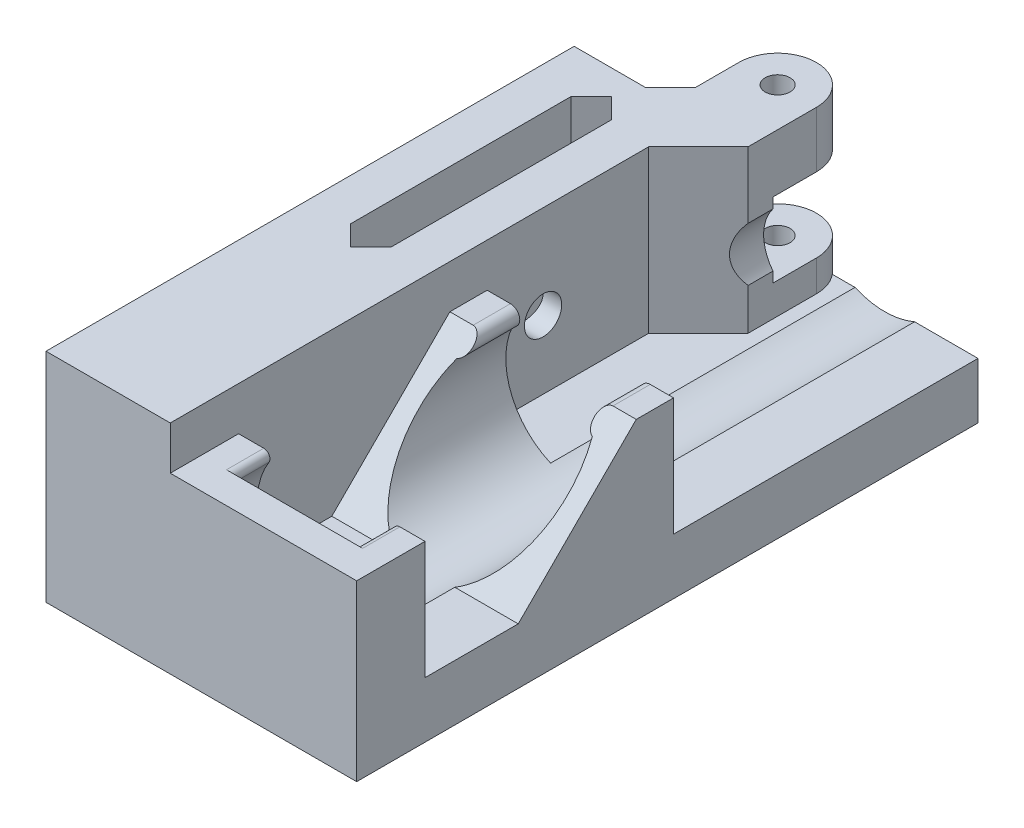
from build123d import *
from build123d.topology import SkipClean

# Parameters (mm, degrees)
SKETCH1_W               = 20
SKETCH1_H               = 30
BOSS_EXTRUDE1_DEPTH     = 85
SKETCH3_R               = 7
CUT_EXTRUDE1_DEPTH      = 75
SKETCH4_R               = 3
CUT_EXTRUDE2_DEPTH      = 89.600225733
SKETCH5_W               = 6.5
SKETCH5_H               = 42
CUT_EXTRUDE3_DEPTH      = 91.691785747
SKETCH6_W               = 85
SKETCH6_H               = 4
BOSS_EXTRUDE2_DEPTH     = 30
BOSS_EXTRUDE3_DEPTH     = 11
SKETCH8_R               = 12
CUT_EXTRUDE4_DEPTH      = 96.131488042
SKETCH9_W               = 30
SKETCH9_H               = 23
BOSS_EXTRUDE4_DEPTH     = 5
BOSS_EXTRUDE5_START     = -45
BOSS_EXTRUDE5_DEPTH     = 6
SKETCH10_W              = 50
SKETCH10_H              = 85
SKETCH10_W_2            = 6.5
SKETCH10_H_2            = 42
BOSS_EXTRUDE6_DEPTH     = 5
BOSS_EXTRUDE7_DEPTH     = 15
BOSS_EXTRUDE8_START     = -9
BOSS_EXTRUDE8_DEPTH     = 35
CUT_EXTRUDE5_DEPTH      = 110.544511501
CUT_EXTRUDE5_DEPTH_BACK = 11
SKETCH13_W              = 12.5
SKETCH13_H              = 12
SKETCH14_R              = 2
CUT_EXTRUDE6_DEPTH      = 25
CUT_EXTRUDE7_DEPTH      = 97.046863561
SKETCH17_R              = 7
CUT_EXTRUDE8_DEPTH      = 10
CHAMFER2_SIZE           = 4
CHAMFER3_START          = 10
CHAMFER3_DEPTH          = 10.204168477
CHAMFER3_START_2        = 29.795831523
CHAMFER3_2_DEPTH        = 10.204168477
CHAMFER3_START_3        = 40
CHAMFER3_3_DEPTH        = 19
BOSS_EXTRUDE9_DEPTH     = 6
FILLET1_R               = 1
BOSS_EXTRUDE10_REACH    = 70.019
CHAMFER5_SIZE           = 3.25


with BuildPart() as part:
    # Sketch1 → Boss-Extrude1 (new body)
    with BuildSketch(Plane.XY):
        Rectangle(SKETCH1_W, SKETCH1_H)
    extrude(amount=BOSS_EXTRUDE1_DEPTH)

    # Sketch3 → Cut-Extrude1 (cut)
    with BuildSketch(Plane.XY):
        Circle(SKETCH3_R)
    extrude(amount=CUT_EXTRUDE1_DEPTH, mode=Mode.SUBTRACT)

    # Sketch4 → Cut-Extrude2 (cut, through all)
    with BuildSketch(Plane.ZY.offset(10)):
        with Locations((25, 0)):
            Circle(SKETCH4_R)
    extrude(amount=-CUT_EXTRUDE2_DEPTH, mode=Mode.SUBTRACT)

    # Sketch5 → Cut-Extrude3 (cut, through all)
    with BuildSketch(Plane(origin=(0, 15, 0), x_dir=(1, 0, 0), z_dir=(0, 1, 0))):
        with Locations((0, -25)):
            Rectangle(SKETCH5_W, SKETCH5_H)
    extrude(amount=-CUT_EXTRUDE3_DEPTH, mode=Mode.SUBTRACT)

    # Sketch6 → Boss-Extrude2 (add)
    with BuildSketch(Plane(origin=(10, 0, 0), x_dir=(0, 0, -1), z_dir=(1, 0, 0))):
        with Locations((-42.5, -13)):
            Rectangle(SKETCH6_W, SKETCH6_H)
    extrude(amount=BOSS_EXTRUDE2_DEPTH)

    # Sketch7 → Boss-Extrude3 (add)
    with BuildSketch(Plane.XY.offset(85)):
        with BuildLine():
            Line((10, -11), (20.204168477, -11))
            ThreePointArc((20.204168477, -11), (14.96132533, -6.574573055), (13, 0))
            Line((13, 0), (13, 8))
            Line((13, 8), (10, 8))
            Line((10, 8), (10, -11))
        make_face()
        with BuildLine():
            Line((40, -11), (40, 8))
            Line((40, 8), (37, 8))
            Line((37, 8), (37, 0))
            ThreePointArc((37, 0), (35.03867467, -6.574573055), (29.795831523, -11))
            Line((29.795831523, -11), (40, -11))
        make_face()
    extrude(amount=-BOSS_EXTRUDE3_DEPTH)

    # Sketch8 → Cut-Extrude4 (cut, through all)
    with SkipClean():  # the faces are left unmerged after this step: merging them gives an invalid solid
        with BuildSketch(Plane.XY.offset(85)):
            with Locations((25, 0)):
                Circle(SKETCH8_R)
        extrude(amount=-CUT_EXTRUDE4_DEPTH, mode=Mode.SUBTRACT)

    # Sketch9 → Boss-Extrude4 (add)
    with SkipClean():  # the faces are left unmerged after this step: merging them gives an invalid solid
        with BuildSketch(Plane.XY.offset(85)):
            with Locations((25, -3.5)):
                Rectangle(SKETCH9_W, SKETCH9_H)
        extrude(amount=-BOSS_EXTRUDE4_DEPTH)

    # Sketch7<3> → Boss-Extrude5 (add)
    with SkipClean():  # the faces are left unmerged after this step: merging them gives an invalid solid
        with BuildSketch(Plane.XY.offset(85).offset(BOSS_EXTRUDE5_START)):
            with BuildLine():
                Line((40, -11), (40, 0))
                Line((40, 0), (40, 8))
                Line((40, 8), (37, 8))
                Line((37, 8), (37, 0))
                ThreePointArc((37, 0), (35.03867467, -6.574573055), (29.795831523, -11))
                Line((29.795831523, -11), (40, -11))
            make_face()
            with BuildLine():
                Line((10, -11), (20.204168477, -11))
                ThreePointArc((20.204168477, -11), (14.96132533, -6.574573055), (13, 0))
                Line((13, 0), (13, 8))
                Line((13, 8), (10, 8))
                Line((10, 8), (10, -11))
            make_face()
        extrude(amount=-BOSS_EXTRUDE5_DEPTH)

    # Sketch10 → Boss-Extrude6 (add)
    with SkipClean():  # the faces are left unmerged after this step: merging them gives an invalid solid
        with BuildSketch(Plane.XZ.offset(15)):
            with Locations((15, 42.5)):
                Rectangle(SKETCH10_W, SKETCH10_H)
            with Locations((0, 25)):
                Rectangle(SKETCH10_W_2, SKETCH10_H_2, mode=Mode.SUBTRACT)
        extrude(amount=BOSS_EXTRUDE6_DEPTH)

    # Sketch11 → Boss-Extrude7 (add)
    with BuildSketch(Plane(origin=(0, 0, 0), x_dir=(-1, 0, 0), z_dir=(0, 0, -1))):
        with BuildLine():
            Line((-10, -11), (10, -11))
            Line((10, -11), (10, -20))
            Line((10, -20), (-40, -20))
            Line((-40, -20), (-40, -11))
            Line((-40, -11), (-29.795831523, -11))
            ThreePointArc((-29.795831523, -11), (-25, -12), (-20.204168477, -11))
            Line((-20.204168477, -11), (-10, -11))
        make_face()
    extrude(amount=BOSS_EXTRUDE7_DEPTH)

    # Sketch12 → Boss-Extrude8 (add)
    with SkipClean():  # the faces are left unmerged after this step: merging them gives an invalid solid
        with BuildSketch(Plane(origin=(0, -11, 0), x_dir=(1, 0, 0), z_dir=(0, 1, 0)).offset(BOSS_EXTRUDE8_START)):
            with BuildLine():
                Line((5.5, 0), (10, 0))
                Line((10, 0), (10, -8))
                Line((10, -8), (18, 0))
                Line((18, 0), (18, 11))
                ThreePointArc((18, 11), (11.75, 17.25), (5.5, 11))
                Line((5.5, 11), (5.5, 0))
            make_face()
        extrude(amount=BOSS_EXTRUDE8_DEPTH)

    # Sketch13 → Cut-Extrude5 (cut, two sides: drawn at the far end of the back side and taken through both)
    with BuildSketch(Plane(origin=(0, 0, -15), x_dir=(-1, 0, 0), z_dir=(0, 0, -1)).offset(-CUT_EXTRUDE5_DEPTH_BACK)):
        with Locations((-11.75, 0)):
            Rectangle(SKETCH13_W, SKETCH13_H)
    extrude(amount=CUT_EXTRUDE5_DEPTH + CUT_EXTRUDE5_DEPTH_BACK, mode=Mode.SUBTRACT)

    # Sketch14 → Cut-Extrude6 (cut)
    with BuildSketch(Plane(origin=(0, 15, 0), x_dir=(1, 0, 0), z_dir=(0, 1, 0))):
        with Locations(Location((11.75, 11, 0), (0, 0, 270))):
            Circle(SKETCH14_R)
    extrude(amount=-CUT_EXTRUDE6_DEPTH, mode=Mode.SUBTRACT)

    # Sketch16 → Cut-Extrude7 (cut, through all)
    with SkipClean():  # the faces are left unmerged after this step: merging them gives an invalid solid
        with BuildSketch(Plane.XY):
            with BuildLine():
                Line((5.5, 4.330127019), (5.5, -4.330127019))
                ThreePointArc((5.5, -4.330127019), (7, 0), (5.5, 4.330127019))
            make_face()
        extrude(amount=-CUT_EXTRUDE7_DEPTH, mode=Mode.SUBTRACT)

    # Sketch17 → Cut-Extrude8 (cut)
    with SkipClean():  # the faces are left unmerged after this step: merging them gives an invalid solid
        with BuildSketch(Plane(origin=(0, 0, -4), x_dir=(-1, 0, 0), z_dir=(0, 0, -1))):
            with Locations((-23.5, 0)):
                Circle(SKETCH17_R)
        extrude(amount=-CUT_EXTRUDE8_DEPTH, mode=Mode.SUBTRACT)

    # Chamfer2
    # the kernel refuses this chamfer: 4 mm, written as the material it adds along each edge
    with BuildSketch(Plane(origin=(5.5, -21.286731952, 0), x_dir=(-1, 0, 0), z_dir=(0, 1, 0))) as chamfer2_piece_1_section:
        Polygon((CHAMFER2_SIZE, 0), (0, -CHAMFER2_SIZE), (0, 0), align=None)
    chamfer2_piece_1 = extrude(amount=27.243336885, mode=Mode.PRIVATE)
    chamfer2_piece_1 = chamfer2_piece_1 - Plane(origin=(0, 0, 0), x_dir=(1, 0, 0), z_dir=(0, 0, -1)) * Cylinder(7, 71, mode=Mode.PRIVATE)
    chamfer2_piece_1 = split(chamfer2_piece_1, bisect_by=Plane(origin=(5.5, -20, 0), z_dir=(0, 1, 0)), keep=Keep.TOP, mode=Mode.PRIVATE)
    add(chamfer2_piece_1)
    with BuildSketch(Plane(origin=(5.5, -5.956604933, 0), x_dir=(-1, 0, 0), z_dir=(0, 1, 0))) as chamfer2_piece_2_section:
        Polygon((CHAMFER2_SIZE, 0), (0, -CHAMFER2_SIZE), (0, 0), align=None)
    chamfer2_piece_2 = extrude(amount=20.956604933, mode=Mode.PRIVATE)
    chamfer2_piece_2 = chamfer2_piece_2 - Plane(origin=(0, 0, 0), x_dir=(1, 0, 0), z_dir=(0, 0, -1)) * Cylinder(7, 58, mode=Mode.PRIVATE)
    add(chamfer2_piece_2)

    # Chamfer3: read off the stored shape, not the designer's step
    # Chamfer3 outline → Chamfer3 (add)
    with SkipClean():  # the faces are left unmerged after this step: merging them gives an invalid solid
        with BuildSketch(Plane.YZ.offset(CHAMFER3_START)):
            Polygon((8, 40), (-11, 59), (-11, 40), align=None)
        extrude(amount=CHAMFER3_DEPTH)
    add(part.part.scale(1), mode=Mode.REPLACE)  # the faces are merged on a copy

    # Chamfer3 2 outline → Chamfer3 2 (add)
    with BuildSketch(Plane.YZ.offset(CHAMFER3_START_2)):
        Polygon((8, 40), (-11, 59), (-11, 40), align=None)
    extrude(amount=CHAMFER3_2_DEPTH)

    # Chamfer3 3 outline → Chamfer3 3 (cut)
    with BuildSketch(Plane.XY.offset(CHAMFER3_START_3)):
        with BuildLine():
            ThreePointArc((29.795831523, -11), (35.03867467, -6.574573055), (37, 0))
            Line((37, 0), (37, 9))
            Line((37, 9), (29.795831523, 9))
            Line((29.795831523, 9), (29.795831523, -11))
        make_face()
        with BuildLine():
            ThreePointArc((13, 0), (14.96132533, -6.574573055), (20.204168477, -11))
            Line((20.204168477, -11), (20.204168477, 9))
            Line((20.204168477, 9), (13, 9))
            Line((13, 9), (13, 0))
        make_face()
    extrude(amount=CHAMFER3_3_DEPTH, mode=Mode.SUBTRACT)

    # Sketch19 → Boss-Extrude9 (add)
    with BuildSketch(Plane(origin=(0, 0, 80), x_dir=(-1, 0, 0), z_dir=(0, 0, -1))):
        with BuildLine():
            Line((-37, 0), (-37, 8))
            Line((-37, 8), (-33.94427191, 8))
            ThreePointArc((-33.94427191, 8), (-36.210068308, 4.281865077), (-37, 0))
        make_face()
        with BuildLine():
            Line((-13, 8), (-13, 0))
            ThreePointArc((-13, 0), (-13.789931692, 4.281865077), (-16.05572809, 8))
            Line((-16.05572809, 8), (-13, 8))
        make_face()
    extrude(amount=BOSS_EXTRUDE9_DEPTH)

    # Fillet1
    # the kernel refuses this fillet: 1 mm, written as the material it takes off along each edge
    with BuildSketch(Plane(origin=(33.94427191, 8, 80), x_dir=(1, 0, 0), z_dir=(0, 0, -1))) as fillet1_piece_1:
        with BuildLine():
            CenterArc((2.01017924, 1), FILLET1_R, 147.421029607, 122.578970393)
            ThreePointArc((1.167529152, 1.538461538), (0.61476545, 0.745704393), (0, 0))
            Line((0, 0), (2.01017924, 0))
        make_face()
    extrude(amount=11.0254481, mode=Mode.SUBTRACT)
    with BuildSketch(Plane(origin=(16.05572809, 8, 80), x_dir=(-1, 0, 0), z_dir=(0, 0, -1))) as fillet1_piece_2:
        with BuildLine():
            CenterArc((2.01017924, -1), FILLET1_R, 90, 122.578970393)
            ThreePointArc((1.167529152, -1.538461538), (0.61476545, -0.745704393), (0, 0))
            Line((0, 0), (2.01017924, 0))
        make_face()
    extrude(amount=11.0254481, mode=Mode.SUBTRACT)

    # Boss-Extrude10: up to this plane
    boss_extrude10_end = Plane(origin=(40, -11, 59), z_dir=(0, -0.7071067811865512, -0.7071067811865438))
    # Sketch20 → Boss-Extrude10 (add, up to the surface)
    with BuildSketch(Plane(origin=(0, 0, 34), x_dir=(-1, 0, 0), z_dir=(0, 0, -1)), mode=Mode.PRIVATE) as boss_extrude10_sk1:
        with BuildLine():
            Line((-36.25, 8), (-37, 8))
            Line((-37, 8), (-37, 0))
            ThreePointArc((-37, 0), (-36.718784369, 2.582652302), (-35.888317848, 5.044257571))
            ThreePointArc((-35.888317848, 5.044257571), (-34.761105503, 6.68218995), (-36.25, 8))
        make_face()
    boss_extrude10_tool1 = split(extrude(boss_extrude10_sk1.sketch, amount=-BOSS_EXTRUDE10_REACH, mode=Mode.PRIVATE), bisect_by=boss_extrude10_end, keep=Keep.BOTH, mode=Mode.PRIVATE)
    add(boss_extrude10_tool1.solids().sort_by_distance((36.164364, 5.853869, 34))[0])
    # Sketch20 → Boss-Extrude10 (add, up to the surface)
    with BuildSketch(Plane(origin=(0, 0, 34), x_dir=(-1, 0, 0), z_dir=(0, 0, -1)), mode=Mode.PRIVATE) as boss_extrude10_sk2:
        with BuildLine():
            Line((-13.75, 8), (-13, 8))
            Line((-13, 8), (-13, 0))
            ThreePointArc((-13, 0), (-13.281215631, 2.582652302), (-14.111682152, 5.044257571))
            ThreePointArc((-14.111682152, 5.044257571), (-15.238894497, 6.68218995), (-13.75, 8))
        make_face()
    boss_extrude10_tool2 = split(extrude(boss_extrude10_sk2.sketch, amount=-BOSS_EXTRUDE10_REACH, mode=Mode.PRIVATE), bisect_by=boss_extrude10_end, keep=Keep.BOTH, mode=Mode.PRIVATE)
    add(boss_extrude10_tool2.solids().sort_by_distance((13.835636, 5.853869, 34))[0])

    # Chamfer5
    # the kernel refuses this chamfer: 3.25 mm, written as the material it adds along each edge
    with BuildSketch(Plane(origin=(3.25, 2.158171327, 4), x_dir=(0, 0, 1), z_dir=(0, -1, 0))) as chamfer5_piece_1_section:
        Polygon((CHAMFER5_SIZE, 0), (0, CHAMFER5_SIZE), (0, 0), align=None)
    chamfer5_piece_1 = extrude(amount=22.158171327, mode=Mode.PRIVATE)
    chamfer5_piece_1 = chamfer5_piece_1 - Plane(origin=(0, 0, 4), x_dir=(1, 0, 0), z_dir=(0, 0, -1)) * Cylinder(7, 58, mode=Mode.PRIVATE)
    add(chamfer5_piece_1)
    with BuildSketch(Plane(origin=(3.25, 15, 46), x_dir=(-1, 0, 0), z_dir=(0, -1, 0))) as chamfer5_piece_2_section:
        Polygon((CHAMFER5_SIZE, 0), (0, CHAMFER5_SIZE), (0, 0), align=None)
    chamfer5_piece_2 = extrude(amount=17.158171327, mode=Mode.PRIVATE)
    chamfer5_piece_2 = chamfer5_piece_2 - Plane(origin=(0, 0, 46), x_dir=(1, 0, 0), z_dir=(0, 0, -1)) * Cylinder(7, 48, mode=Mode.PRIVATE)
    add(chamfer5_piece_2)
    with BuildSketch(Plane(origin=(-3.25, 15, 46), x_dir=(0, 0, -1), z_dir=(0, -1, 0))) as chamfer5_piece_3_section:
        Polygon((CHAMFER5_SIZE, 0), (0, CHAMFER5_SIZE), (0, 0), align=None)
    chamfer5_piece_3 = extrude(amount=17.158171327, mode=Mode.PRIVATE)
    chamfer5_piece_3 = chamfer5_piece_3 - Plane(origin=(0, 0, 46), x_dir=(1, 0, 0), z_dir=(0, 0, -1)) * Cylinder(7, 48, mode=Mode.PRIVATE)
    add(chamfer5_piece_3)
    with BuildSketch(Plane(origin=(-3.25, 15, 4), x_dir=(0, 0, 1), z_dir=(0, -1, 0))) as chamfer5_piece_4_section:
        Polygon((CHAMFER5_SIZE, 0), (0, -CHAMFER5_SIZE), (0, 0), align=None)
    chamfer5_piece_4 = extrude(amount=17.158171327, mode=Mode.PRIVATE)
    chamfer5_piece_4 = chamfer5_piece_4 - Plane(origin=(0, 0, 4), x_dir=(1, 0, 0), z_dir=(0, 0, -1)) * Cylinder(7, 48, mode=Mode.PRIVATE)
    add(chamfer5_piece_4)
    with BuildSketch(Plane(origin=(3.25, 15, 4), x_dir=(-1, 0, 0), z_dir=(0, -1, 0))) as chamfer5_piece_5_section:
        Polygon((CHAMFER5_SIZE, 0), (0, -CHAMFER5_SIZE), (0, 0), align=None)
    chamfer5_piece_5 = extrude(amount=17.158171327, mode=Mode.PRIVATE)
    chamfer5_piece_5 = chamfer5_piece_5 - Plane(origin=(0, 0, 4), x_dir=(1, 0, 0), z_dir=(0, 0, -1)) * Cylinder(7, 48, mode=Mode.PRIVATE)
    add(chamfer5_piece_5)
    with BuildSketch(Plane(origin=(3.25, -20, 46), x_dir=(0, 0, -1), z_dir=(0, 1, 0))) as chamfer5_piece_6_section:
        Polygon((CHAMFER5_SIZE, 0), (0, CHAMFER5_SIZE), (0, 0), align=None)
    chamfer5_piece_6 = extrude(amount=22.158171327, mode=Mode.PRIVATE)
    chamfer5_piece_6 = chamfer5_piece_6 - Plane(origin=(0, 0, 46), x_dir=(1, 0, 0), z_dir=(0, 0, -1)) * Cylinder(7, 58, mode=Mode.PRIVATE)
    add(chamfer5_piece_6)
    with BuildSketch(Plane(origin=(-3.25, -20, 46), x_dir=(1, 0, 0), z_dir=(0, 1, 0))) as chamfer5_piece_7_section:
        Polygon((CHAMFER5_SIZE, 0), (0, CHAMFER5_SIZE), (0, 0), align=None)
    chamfer5_piece_7 = extrude(amount=22.158171327, mode=Mode.PRIVATE)
    chamfer5_piece_7 = chamfer5_piece_7 - Plane(origin=(0, 0, 46), x_dir=(1, 0, 0), z_dir=(0, 0, -1)) * Cylinder(7, 58, mode=Mode.PRIVATE)
    add(chamfer5_piece_7)
    with BuildSketch(Plane(origin=(-3.25, 2.158171327, 4), x_dir=(1, 0, 0), z_dir=(0, -1, 0))) as chamfer5_piece_8_section:
        Polygon((CHAMFER5_SIZE, 0), (0, CHAMFER5_SIZE), (0, 0), align=None)
    chamfer5_piece_8 = extrude(amount=22.158171327, mode=Mode.PRIVATE)
    chamfer5_piece_8 = chamfer5_piece_8 - Plane(origin=(0, 0, 4), x_dir=(1, 0, 0), z_dir=(0, 0, -1)) * Cylinder(7, 58, mode=Mode.PRIVATE)
    add(chamfer5_piece_8)


solid = part.part
